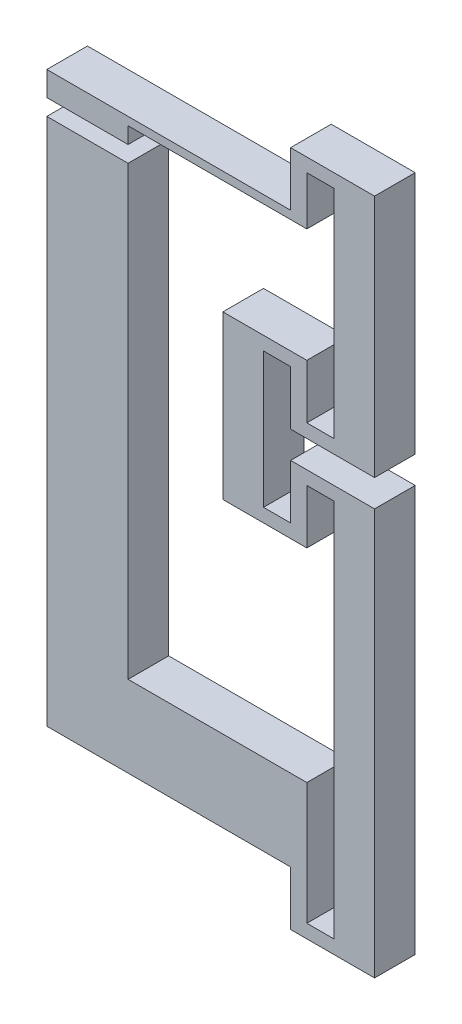
from build123d import *

# Parameters (mm, degrees)
BOSS_EXTRUDE1_DEPTH = 5


with BuildPart() as part:
    # Sketch1 → Boss-Extrude1 (new body)
    with BuildSketch(Plane.XY):
        Polygon((0, 0), (0, 65), (10, 65), (10, 10), (32, 10), (32, -3.168829952), (32, -5), (35.3333, -5), (35.3333, 41.6666), (32, 41.6666), (32, 36.6666), (32, 34.9999), (21.6667, 34.9999), (21.6667, 54.9999), (32, 54.9999), (32, 53.3332), (32, 48.3332), (35.3333, 48.3332), (35.3333, 74.9998), (32, 74.9998), (32, 69.9998), (32, 68.9998), (10, 68.9998), (10, 66.9998), (0, 66.9998), (0, 69.9998), (30, 69.9998), (30, 76.6665), (40.3333, 76.6665), (40.3333, 46.6665), (30, 46.6665), (30, 53.3332), (26.6667, 53.3332), (26.6667, 36.6666), (30, 36.6666), (30, 43.3333), (40.3333, 43.3333), (40.3333, -6.6667), (30, -6.6667), (30, -5), (30, 0), align=None)
    extrude(amount=BOSS_EXTRUDE1_DEPTH)


solid = part.part
